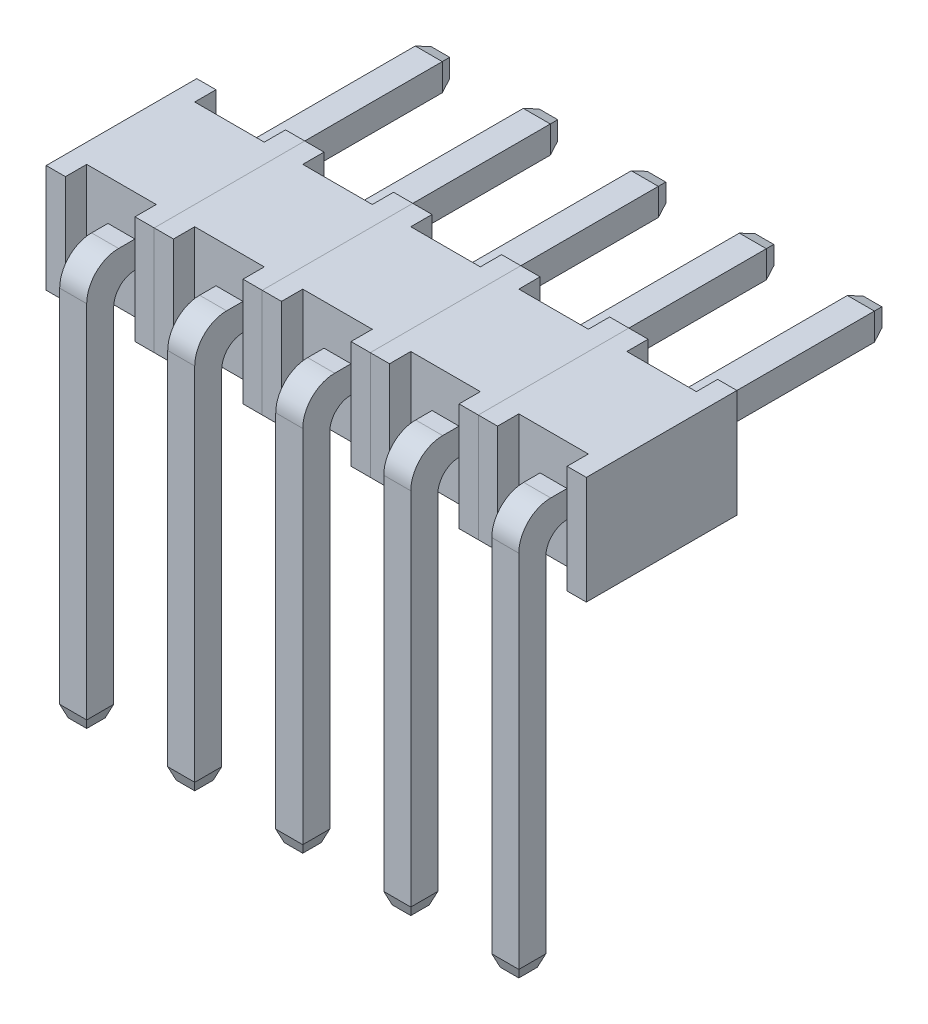
from build123d import *

# Parameters (mm, degrees)
SKETCH2_W             = 0.635
SKETCH2_H             = 9.5
BOSS_EXTRUDE1_DEPTH   = 0.635
SKETCH3_W             = 0.635
SKETCH3_H             = 0.635
BOSS_EXTRUDE2_DEPTH   = 8
FILLET1_R             = 0.5
FILLET2_R             = 0.75
SKETCH4_W             = 0.4525
SKETCH4_H             = 2.54
BOSS_EXTRUDE3_DEPTH   = 0.5
BOSS_EXTRUDE3_2_DEPTH = 0.5
SKETCH5_W             = 2.54
SKETCH5_H             = 2.54
BOSS_EXTRUDE4_DEPTH   = 2.54
SKETCH6_W             = 0.4525
SKETCH6_H             = 2.54
BOSS_EXTRUDE5_DEPTH   = 0.5
CHAMFER1_SIZE         = 0.1
CHAMFER1_SIZE2        = 0.274747742
CHAMFER2_SIZE         = 0.1
CHAMFER2_SIZE2        = 0.274747742
NUM_PINS_COUNT        = 5
NUM_PINS_PITCH        = 2.54


with BuildPart() as part:
    # Sketch2 → Boss-Extrude1 (new body)
    with BuildSketch(Plane.XY):
        with Locations((1.27, 4.75)):
            Rectangle(SKETCH2_W, SKETCH2_H)
    extrude(amount=-BOSS_EXTRUDE1_DEPTH)

    # Sketch3 → Boss-Extrude2 (add)
    with BuildSketch(Plane(origin=(0, 0, -0.635), x_dir=(-1, 0, 0), z_dir=(0, 0, -1))):
        with Locations((-1.27, 9.1825)):
            Rectangle(SKETCH3_W, SKETCH3_H)
    extrude(amount=BOSS_EXTRUDE2_DEPTH)

    # Fillet1
    fillet1_edges = [part.edges().sort_by_distance(p)[0] for p in [
        (1.27, 8.865, -0.635),
    ]]
    fillet(fillet1_edges, radius=FILLET1_R)

    # Fillet2
    fillet2_edges = [part.edges().sort_by_distance(p)[0] for p in [
        (1.27, 9.5, 0),
    ]]
    fillet(fillet2_edges, radius=FILLET2_R)



with BuildPart() as body_2:
    # Sketch4 → Boss-Extrude3 (new body)
    with BuildSketch(Plane(origin=(0, 0, -0.635), x_dir=(-1, 0, 0), z_dir=(0, 0, -1))):
        with Locations((-0.22625, 9.1825)):
            Rectangle(SKETCH4_W, SKETCH4_H)
    extrude(amount=BOSS_EXTRUDE3_DEPTH)


with BuildPart() as body_3:
    # Sketch4 → Boss-Extrude3 2 (new body)
    with BuildSketch(Plane(origin=(0, 0, -0.635), x_dir=(-1, 0, 0), z_dir=(0, 0, -1))):
        with Locations((-2.31375, 9.1825)):
            Rectangle(SKETCH4_W, SKETCH4_H)
    extrude(amount=BOSS_EXTRUDE3_2_DEPTH)


with BuildPart() as part_1:
    add(part.part)

    add(body_2.part)  # Boss-Extrude4 merges body 2

    add(body_3.part)  # Boss-Extrude4 merges body 3
    # Sketch5 → Boss-Extrude4 (add)
    with BuildSketch(Plane(origin=(0, 0, -1.135), x_dir=(-1, 0, 0), z_dir=(0, 0, -1))):
        with Locations((-1.27, 9.1825)):
            Rectangle(SKETCH5_W, SKETCH5_H)
    extrude(amount=BOSS_EXTRUDE4_DEPTH)

    # Sketch6 → Boss-Extrude5 (add)
    with BuildSketch(Plane(origin=(0, 0, -3.675), x_dir=(-1, 0, 0), z_dir=(0, 0, -1))):
        with Locations((-0.22625, 9.1825)):
            Rectangle(SKETCH6_W, SKETCH6_H)
        with Locations((-2.31375, 9.1825)):
            Rectangle(SKETCH6_W, SKETCH6_H)
    extrude(amount=BOSS_EXTRUDE5_DEPTH)

    # Chamfer1
    chamfer1_edges = [part_1.edges().sort_by_distance(p)[0] for p in [
        (1.27, 8.865, -8.635),
        (1.5875, 9.1825, -8.635),
        (1.27, 9.5, -8.635),
        (0.9525, 9.1825, -8.635),
    ]]
    chamfer1_side = [part_1.faces().sort_by_distance(p)[0] for p in [
        (1.27, 9.1825, -8.635),
    ]]
    chamfer(chamfer1_edges, length=CHAMFER1_SIZE, length2=CHAMFER1_SIZE2, reference=chamfer1_side[0])

    # Chamfer2
    chamfer2_edges = [part_1.edges().sort_by_distance(p)[0] for p in [
        (1.5875, 0, -0.3175),
        (1.27, 0, -0.635),
        (0.9525, 0, -0.3175),
        (1.27, 0, 0),
    ]]
    chamfer2_side = [part_1.faces().sort_by_distance(p)[0] for p in [
        (1.27, 0, -0.3175),
    ]]
    chamfer(chamfer2_edges, length=CHAMFER2_SIZE, length2=CHAMFER2_SIZE2, reference=chamfer2_side[0])


with BuildPart() as num_pins_1:
    # Num pins: pattern copy
    add(part_1.part.moved(Location(Vector(1, 0, 0) * (1 * NUM_PINS_PITCH))))


with BuildPart() as num_pins_2:
    # Num pins: pattern copy
    add(part_1.part.moved(Location(Vector(1, 0, 0) * (2 * NUM_PINS_PITCH))))


with BuildPart() as num_pins_3:
    # Num pins: pattern copy
    add(part_1.part.moved(Location(Vector(1, 0, 0) * (3 * NUM_PINS_PITCH))))


with BuildPart() as num_pins_4:
    # Num pins: pattern copy
    add(part_1.part.moved(Location(Vector(1, 0, 0) * (4 * NUM_PINS_PITCH))))


solid = Compound([part_1.part, num_pins_1.part, num_pins_2.part, num_pins_3.part, num_pins_4.part])
